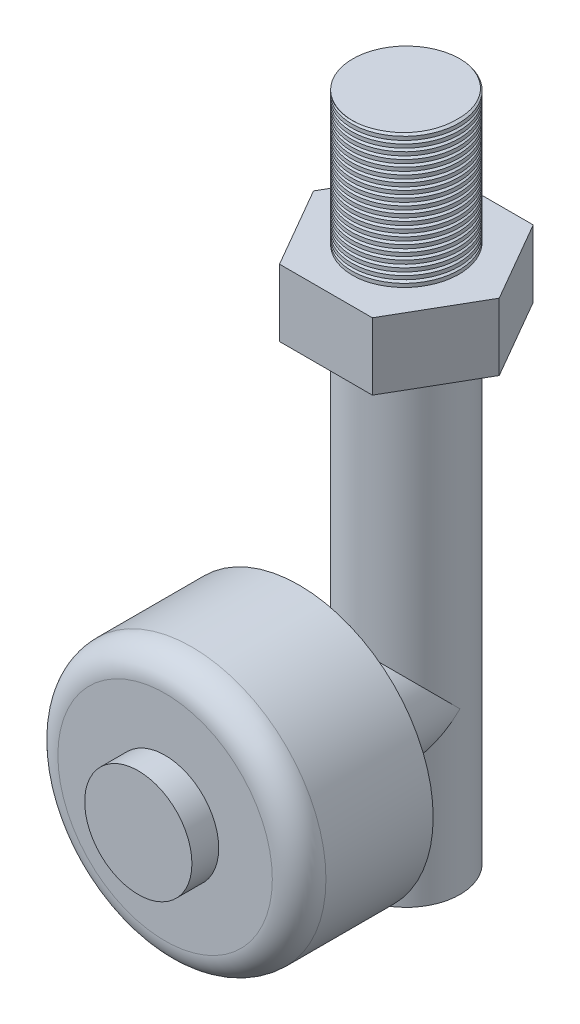
from build123d import *

# Parameters (mm, degrees)
CROQUIS1_R               = 4
SALIENTE_EXTRUIR1_DEPTH  = 35
SALIENTE_EXTRUIR3_DEPTH  = 5
CROQUIS3_R               = 4
SALIENTE_EXTRUIR4_DEPTH  = 20
CROQUIS4_R               = 10
SALIENTE_EXTRUIR7_DEPTH  = 12
CROQUIS6_R               = 10
CORTAR_EXTRUIR2_DEPTH    = 2
CROQUIS7_R               = 4
SALIENTE_EXTRUIR8_DEPTH  = 2
CROQUIS9_W               = 28.080136087
CROQUIS9_H               = 24.345011097
CORTAR_EXTRUIR3_DEPTH    = 5
SALIENTE_EXTRUIR9_DEPTH  = 5
CROQUIS11_R              = 4
SALIENTE_EXTRUIR10_DEPTH = 5
CORTAR_BARRER1_PITCH     = 0.5
REDONDEO1_R              = 2
CROQUIS14_R              = 4
SALIENTE_EXTRUIR11_DEPTH = 10
CORTAR_BARRER2_PITCH     = 0.5
CORTAR_BARRER2_TO        = 10


with BuildPart() as part:
    # Croquis1 → Saliente-Extruir1 (new body)
    with BuildSketch(Plane(origin=(0, 0, 0), x_dir=(1, 0, 0), z_dir=(0, 1, 0))):
        with Locations(Location((0, 0, 0), (0, 0, 270))):
            Circle(CROQUIS1_R)
    extrude(amount=SALIENTE_EXTRUIR1_DEPTH)

    # Croquis2 → Saliente-Extruir3 (add)
    with BuildSketch(Plane(origin=(0, 35, 0), x_dir=(1, 0, 0), z_dir=(0, 1, 0))):
        Polygon((4.135288052, -6.985725944), (7.86374441, -2.015563963), (6.985725944, 4.135288052), (2.015563963, 7.86374441), (-4.135288052, 6.985725944), (-7.86374441, 2.015563963), (-6.985725944, -4.135288052), (-2.015563963, -7.86374441), align=None)
    extrude(amount=SALIENTE_EXTRUIR3_DEPTH)

    # Croquis3 → Saliente-Extruir4 (add)
    with BuildSketch(Plane.XY):
        with Locations((0, 12)):
            Circle(CROQUIS3_R)
    extrude(amount=SALIENTE_EXTRUIR4_DEPTH)

    # Croquis4 → Saliente-Extruir7 (add)
    with BuildSketch(Plane.XY.offset(20)):
        with Locations((0, 12)):
            Circle(CROQUIS4_R)
    extrude(amount=-SALIENTE_EXTRUIR7_DEPTH)

    # Croquis6 → Cortar-Extruir2 (cut)
    with BuildSketch(Plane.XY.offset(20)):
        with Locations((0, 12)):
            Circle(CROQUIS6_R)
    extrude(amount=-CORTAR_EXTRUIR2_DEPTH, mode=Mode.SUBTRACT)

    # Croquis7 → Saliente-Extruir8 (add)
    with BuildSketch(Plane.XY.offset(18)):
        with Locations((0, 12)):
            Circle(CROQUIS7_R)
    extrude(amount=SALIENTE_EXTRUIR8_DEPTH)

    # Croquis9 → Cortar-Extruir3 (cut)
    with BuildSketch(Plane(origin=(0, 40, 0), x_dir=(1, 0, 0), z_dir=(0, 1, 0))):
        with Locations((0.566938615, 2.002410131)):
            Rectangle(CROQUIS9_W, CROQUIS9_H)
    extrude(amount=-CORTAR_EXTRUIR3_DEPTH, mode=Mode.SUBTRACT)

    # Croquis10 → Saliente-Extruir9 (add)
    with BuildSketch(Plane(origin=(0, 35, 0), x_dir=(1, 0, 0), z_dir=(0, 1, 0))):
        Polygon((6.92820323, 0), (3.464101615, 6), (-3.464101615, 6), (-6.92820323, 0), (-3.464101615, -6), (3.464101615, -6), align=None)
    extrude(amount=SALIENTE_EXTRUIR9_DEPTH)

    # Croquis11 → Saliente-Extruir10 (add)
    with BuildSketch(Plane(origin=(0, 40, 0), x_dir=(1, 0, 0), z_dir=(0, 1, 0))):
        with Locations(Location((0, 0, 0), (0, 0, 270))):
            Circle(CROQUIS11_R)
    extrude(amount=SALIENTE_EXTRUIR10_DEPTH)

    # Cortar-Barrer1: arcs per turn and ends read off the stored shape
    # Cortar-Barrer1: the profile of Croquis13 screwed along a right-hand helix through 8 turns, 6 arcs to a turn; built about Z, then put on its axis
    cortar_barrer1_z = Axis((0, 0, 0), (0, 0, 1))
    cortar_barrer1_corners = [(4.1, 0, 0.048205081), (3.8, 0, -0.125), (4.1, 0, -0.298205081)]
    with BuildLine(mode=Mode.PRIVATE) as cortar_barrer1_profile:
        Line(cortar_barrer1_corners[0], cortar_barrer1_corners[1])
        Line(cortar_barrer1_corners[1], cortar_barrer1_corners[2])
        Line(cortar_barrer1_corners[2], cortar_barrer1_corners[0])
    cortar_barrer1_cap = Face(cortar_barrer1_profile.wire())
    cortar_barrer1_turn_angles = [0, 30, 60, 90, 120, 150, 180, 210, 240, 270, 300, 330, 360]
    cortar_barrer1_turn_weights = [1, 0.8660254037844387, 1, 0.8660254037844387, 1, 0.8660254037844387, 1, 0.8660254037844387, 1, 0.8660254037844387, 1, 0.8660254037844387, 1]
    cortar_barrer1_turn_rails = [Edge.make_bspline([Vector(p[0], p[1], 0).rotate(cortar_barrer1_z, cortar_barrer1_turn_angles[k]) / cortar_barrer1_turn_weights[k] + Vector(0, 0, p[2] + CORTAR_BARRER1_PITCH * cortar_barrer1_turn_angles[k] / 360) for k in range(13)], [0, 0, 0, 1, 1, 2, 2, 3, 3, 4, 4, 5, 5, 6, 6, 6], 2, cortar_barrer1_turn_weights) for p in cortar_barrer1_corners]
    cortar_barrer1_turn_sides = [Face.make_surface_from_curves(cortar_barrer1_turn_rails[p[0]], cortar_barrer1_turn_rails[p[1]]) for p in [(0, 1), (1, 2), (2, 0)]]
    cortar_barrer1 = Plane(origin=(0, 45, 0), x_dir=(0, 0, -1), z_dir=(0, -1, 0)) * Solid(Shell([*[p.moved(Location((0, 0, CORTAR_BARRER1_PITCH * i))) for i in range(8) for p in cortar_barrer1_turn_sides], cortar_barrer1_cap, cortar_barrer1_cap.rotate(cortar_barrer1_z, 2880).moved(Location((0, 0, CORTAR_BARRER1_PITCH * 2880 / 360)))]))
    add(cortar_barrer1, mode=Mode.SUBTRACT)

    # Redondeo1
    redondeo1_edges = [part.edges().sort_by_distance(p)[0] for p in [
        (-10, 12, 18),
    ]]
    fillet(redondeo1_edges, radius=REDONDEO1_R)

    # Croquis14 → Saliente-Extruir11 (add)
    with BuildSketch(Plane(origin=(0, 40, 0), x_dir=(1, 0, 0), z_dir=(0, 1, 0))):
        with Locations(Location((0, 0, 0), (0, 0, 270))):
            Circle(CROQUIS14_R)
    extrude(amount=SALIENTE_EXTRUIR11_DEPTH)

    # Cortar-Barrer2: arcs per turn and ends read off the stored shape
    # Cortar-Barrer2: the profile of Croquis16 screwed along a right-hand helix through 21.666667 turns, 6 arcs to a turn; built about Z, then put on its axis
    cortar_barrer2_z = Axis((0, 0, 0), (0, 0, 1))
    cortar_barrer2_corners = [(3.8, 0, -0.5), (4.1, 0, -0.326794919), (4.1, 0, -0.673205081)]
    with BuildLine(mode=Mode.PRIVATE) as cortar_barrer2_profile:
        Line(cortar_barrer2_corners[0], cortar_barrer2_corners[1])
        Line(cortar_barrer2_corners[1], cortar_barrer2_corners[2])
        Line(cortar_barrer2_corners[2], cortar_barrer2_corners[0])
    cortar_barrer2_cap = Face(cortar_barrer2_profile.wire())
    cortar_barrer2_turn_angles = [0, 30, 60, 90, 120, 150, 180, 210, 240, 270, 300, 330, 360]
    cortar_barrer2_turn_weights = [1, 0.8660254037844387, 1, 0.8660254037844387, 1, 0.8660254037844387, 1, 0.8660254037844387, 1, 0.8660254037844387, 1, 0.8660254037844387, 1]
    cortar_barrer2_turn_rails = [Edge.make_bspline([Vector(p[0], p[1], 0).rotate(cortar_barrer2_z, cortar_barrer2_turn_angles[k]) / cortar_barrer2_turn_weights[k] + Vector(0, 0, p[2] + CORTAR_BARRER2_PITCH * cortar_barrer2_turn_angles[k] / 360) for k in range(13)], [0, 0, 0, 1, 1, 2, 2, 3, 3, 4, 4, 5, 5, 6, 6, 6], 2, cortar_barrer2_turn_weights) for p in cortar_barrer2_corners]
    cortar_barrer2_turn_sides = [Face.make_surface_from_curves(cortar_barrer2_turn_rails[p[0]], cortar_barrer2_turn_rails[p[1]]) for p in [(0, 1), (1, 2), (2, 0)]]
    cortar_barrer2_last_angles = [7560, 7590, 7620, 7650, 7680, 7710, 7740, 7770, 7800]
    cortar_barrer2_last_weights = [1, 0.8660254037844387, 1, 0.8660254037844387, 1, 0.8660254037844387, 1, 0.8660254037844387, 1]
    cortar_barrer2_last_rails = [Edge.make_bspline([Vector(p[0], p[1], 0).rotate(cortar_barrer2_z, cortar_barrer2_last_angles[k]) / cortar_barrer2_last_weights[k] + Vector(0, 0, p[2] + CORTAR_BARRER2_PITCH * cortar_barrer2_last_angles[k] / 360) for k in range(9)], [0, 0, 0, 1, 1, 2, 2, 3, 3, 4, 4, 4], 2, cortar_barrer2_last_weights) for p in cortar_barrer2_corners]
    cortar_barrer2_last_sides = [Face.make_surface_from_curves(cortar_barrer2_last_rails[p[0]], cortar_barrer2_last_rails[p[1]]) for p in [(0, 1), (1, 2), (2, 0)]]
    cortar_barrer2 = Plane(origin=(0, 50, 0), x_dir=(1, 0, 0), z_dir=(0, -1, 0)) * split(Solid(Shell([*[p.moved(Location((0, 0, CORTAR_BARRER2_PITCH * i))) for i in range(21) for p in cortar_barrer2_turn_sides], *cortar_barrer2_last_sides, cortar_barrer2_cap, cortar_barrer2_cap.rotate(cortar_barrer2_z, 7800).moved(Location((0, 0, CORTAR_BARRER2_PITCH * 7800 / 360)))])), bisect_by=Plane.XY.offset(CORTAR_BARRER2_TO), keep=Keep.BOTTOM, mode=Mode.PRIVATE)
    add(cortar_barrer2, mode=Mode.SUBTRACT)


solid = part.part
